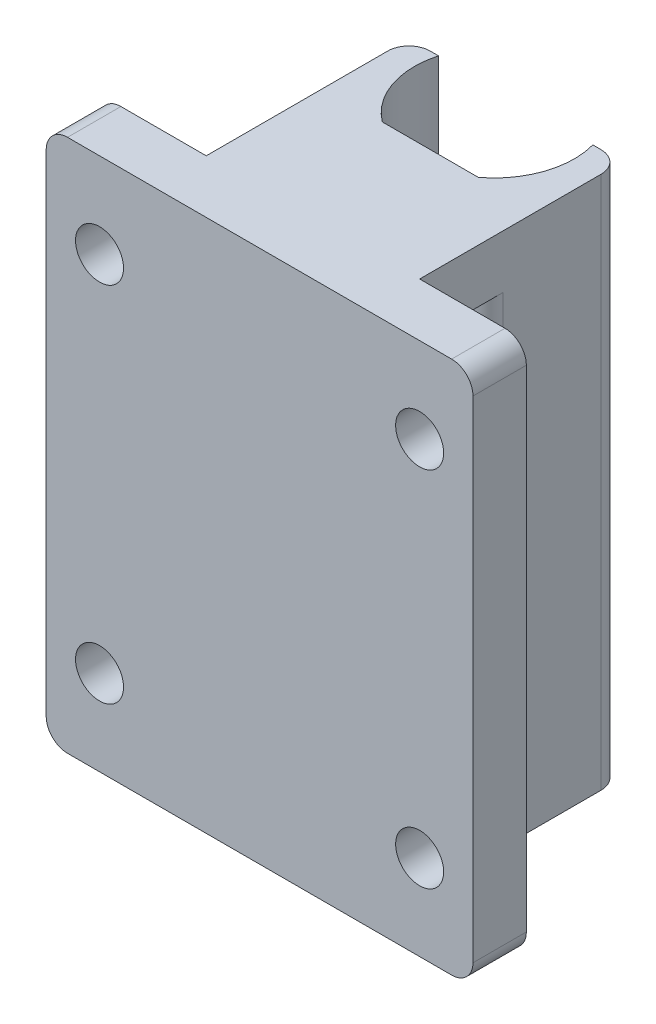
from build123d import *

# Parameters (mm, degrees)
BOSS_EXTRUDE1_DEPTH = 50
SKETCH2_W           = 14.456832295
SKETCH2_H           = 2.5
BOSS_EXTRUDE2_DEPTH = 10
FILLET1_R           = 2
SKETCH3_R           = 2.25
CUT_EXTRUDE1_DEPTH  = 64.770598915
SKETCH4_W           = 2
SKETCH4_H           = 5
CUT_EXTRUDE2_DEPTH  = 64.055531082
FILLET2_R           = 2


with BuildPart() as part:
    # Sketch1 → Boss-Extrude1 (new body)
    with BuildSketch(Plane(origin=(0, 0, 0), x_dir=(1, 0, 0), z_dir=(0, 1, 0))):
        with BuildLine():
            Line((-5.276963181, 0), (34.723036819, 0))
            Line((34.723036819, 0), (34.723036819, 5))
            Line((34.723036819, 5), (24.723036819, 5))
            Line((24.723036819, 5), (24.723036819, 24))
            Line((24.723036819, 24), (21.951452967, 24))
            ThreePointArc((21.951452967, 24), (14.723036819, 14.5), (7.494620672, 24))
            Line((7.494620672, 24), (4.723036819, 24))
            Line((4.723036819, 24), (4.723036819, 5))
            Line((4.723036819, 5), (-5.276963181, 5))
            Line((-5.276963181, 5), (-5.276963181, 0))
        make_face()
    extrude(amount=BOSS_EXTRUDE1_DEPTH)

    # Sketch2 → Boss-Extrude2 (add)
    with BuildSketch(Plane(origin=(0, 0, -16), x_dir=(-1, 0, 0), z_dir=(0, 0, -1))):
        with Locations((-14.72303682, 48.75)):
            Rectangle(SKETCH2_W, SKETCH2_H)
        with Locations((-14.72303682, 1.25)):
            Rectangle(SKETCH2_W, SKETCH2_H)
    extrude(amount=-BOSS_EXTRUDE2_DEPTH)

    # Fillet1
    fillet1_edges = [part.edges().sort_by_distance(p)[0] for p in [
        (-5.276963181, 50, -2.5),
        (-5.276963181, 0, -2.5),
        (34.723036819, 50, -2.5),
        (34.723036819, 0, -2.5),
        (4.723036819, 25, -24),
        (24.723036819, 25, -24),
    ]]
    fillet(fillet1_edges, radius=FILLET1_R)

    # Sketch3 → Cut-Extrude1 (cut, through all)
    with BuildSketch(Plane(origin=(0, 0, -5), x_dir=(-1, 0, 0), z_dir=(0, 0, -1))):
        with Locations((-29.723036819, 42)):
            Circle(SKETCH3_R)
        with Locations((0.276963181, 42)):
            Circle(SKETCH3_R)
        with Locations((0.276963181, 8)):
            Circle(SKETCH3_R)
        with Locations((-29.723036819, 8)):
            Circle(SKETCH3_R)
    extrude(amount=-CUT_EXTRUDE1_DEPTH, mode=Mode.SUBTRACT)

    # Sketch4 → Cut-Extrude2 (cut, through all)
    with BuildSketch(Plane.ZY.offset(-4.723036819)):
        with Locations((-9.802694021, 42.5)):
            Rectangle(SKETCH4_W, SKETCH4_H)
        with Locations((-9.802694021, 7.5)):
            Rectangle(SKETCH4_W, SKETCH4_H)
    extrude(amount=-CUT_EXTRUDE2_DEPTH, mode=Mode.SUBTRACT)

    # Fillet2
    fillet2_edges = [part.edges().sort_by_distance(p)[0] for p in [
        (4.723036819, 42.5, -10.802694021),
        (4.723036819, 7.5, -10.802694021),
        (24.723036819, 7.5, -10.802694021),
        (24.723036819, 42.5, -10.802694021),
    ]]
    fillet(fillet2_edges, radius=FILLET2_R)


solid = part.part
